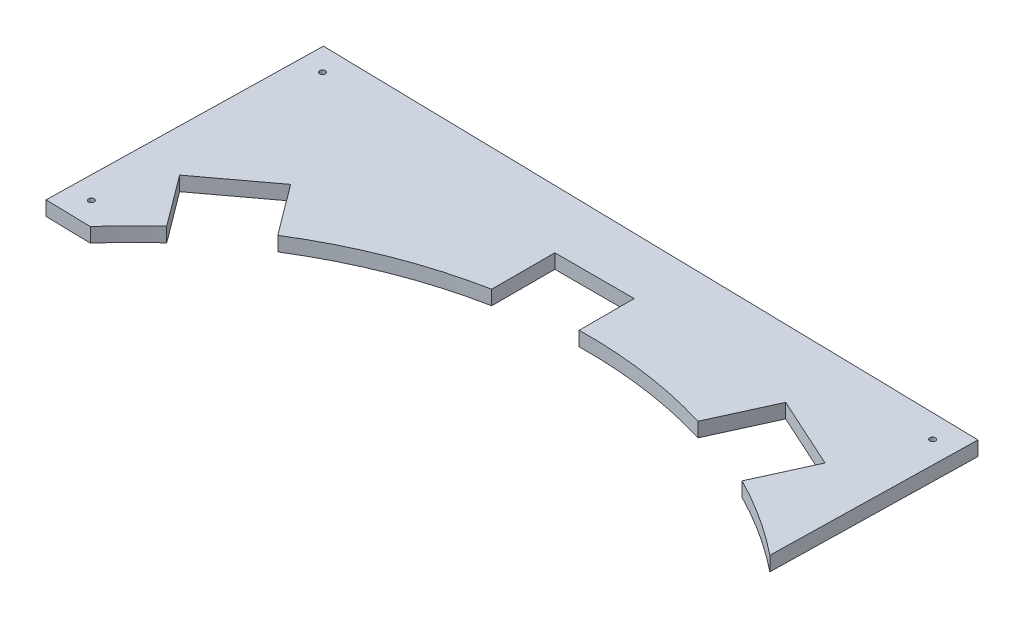
from build123d import *

# Parameters (mm, degrees)
SKETCH1_R           = 1.25
BOSS_EXTRUDE1_DEPTH = 6.35


with BuildPart() as part:
    # Sketch1 → Boss-Extrude1 (new body)
    with BuildSketch(Plane(origin=(0, 0, 0), x_dir=(1, 0, 0), z_dir=(0, 1, 0))):
        with BuildLine():
            Line((-12.884325045, 57.589892951), (-32.880086413, 58.0016299))
            Line((-32.880086413, 58.0016299), (-30.409664718, 177.976198108))
            Line((-30.409664718, 177.976198108), (264.52781546, 171.903078107))
            Line((264.52781546, 171.903078107), (262.674606435, 81.903078107))
            ThreePointArc((262.674606435, 81.903078107), (245.966301841, 93.936578204), (228.109303454, 104.188415872))
            Line((228.109303454, 104.188415872), (239.565645069, 129.341286502))
            Line((239.565645069, 129.341286502), (207.713903894, 143.848752998))
            Line((207.713903894, 143.848752998), (195.598020496, 117.247831174))
            ThreePointArc((195.598020496, 117.247831174), (165.438476431, 123.896281605), (134.614931972, 125.822183564))
            Line((134.614931972, 125.822183564), (134.614931972, 150.073013143))
            Line((134.614931972, 150.073013143), (99.614931972, 150.073013143))
            Line((99.614931972, 150.073013143), (99.614931972, 122.205605467))
            ThreePointArc((99.614931972, 122.205605467), (64.494604203, 112.00765114), (31.818351454, 95.585160423))
            Line((31.818351454, 95.585160423), (15.189825734, 117.890629233))
            Line((15.189825734, 117.890629233), (-12.870789642, 96.971693679))
            Line((-12.870789642, 96.971693679), (3.847059798, 74.546406222))
            ThreePointArc((3.847059798, 74.546406222), (-4.771312567, 66.317474746), (-12.884325045, 57.589892951))
        make_face()
        with Locations((-20.617652508, 167.77244895)):
            Circle(SKETCH1_R, mode=Mode.SUBTRACT)
        with Locations((254.324066301, 162.111065898)):
            Circle(SKETCH1_R, mode=Mode.SUBTRACT)
        with Locations((-22.676337254, 67.79364211)):
            Circle(SKETCH1_R, mode=Mode.SUBTRACT)
    extrude(amount=BOSS_EXTRUDE1_DEPTH)


solid = part.part
